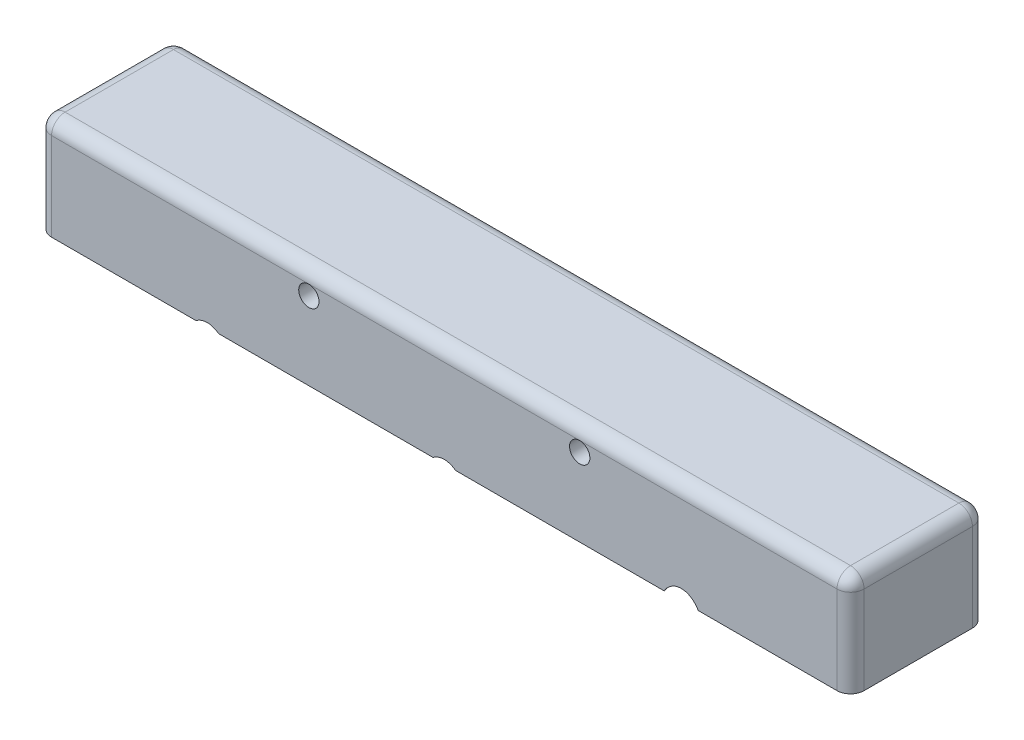
from build123d import *

# Parameters (mm, degrees)
SKETCH1_W           = 120
SKETCH1_H           = 15
BOSS_EXTRUDE1_DEPTH = 15
CUT_EXTRUDE4_START  = -3
SKETCH2_R           = 6
CUT_EXTRUDE4_DEPTH  = 114
SKETCH3_W           = 120
SKETCH3_H           = 15
BOSS_EXTRUDE2_DEPTH = 5
SKETCH5_R           = 3
CUT_EXTRUDE5_DEPTH  = 11
SKETCH6_R           = 1.5
CUT_EXTRUDE6_DEPTH  = 66
FILLET2_R           = 2
FILLET3_R           = 2
FILLET4_R           = 2
FILLET5_R           = 2


with BuildPart() as part:
    # Sketch1 → Boss-Extrude1 (new body)
    with BuildSketch(Plane(origin=(0, 0, 0), x_dir=(1, 0, 0), z_dir=(0, 1, 0))):
        Rectangle(SKETCH1_W, SKETCH1_H)
    extrude(amount=BOSS_EXTRUDE1_DEPTH)

    # Sketch2 → Cut-Extrude4 (cut)
    with BuildSketch(Plane.ZY.offset(60).offset(CUT_EXTRUDE4_START)):
        Circle(SKETCH2_R)
    extrude(amount=-CUT_EXTRUDE4_DEPTH, mode=Mode.SUBTRACT)

    # Sketch3 → Boss-Extrude2 (add)
    with BuildSketch(Plane.XY.offset(7.5)):
        with Locations((0, 7.5)):
            Rectangle(SKETCH3_W, SKETCH3_H)
    extrude(amount=BOSS_EXTRUDE2_DEPTH)

    # Sketch5 → Cut-Extrude5 (cut)
    with BuildSketch(Plane(origin=(0, -5.412658774, 9.375), x_dir=(1, 0, 0), z_dir=(0, -0.499999999999998, 0.8660254037844398))):
        with Locations((-35, 3.75)):
            Circle(SKETCH5_R)
        with Locations((0, 3.75)):
            Circle(SKETCH5_R)
        with Locations((35, 4.610408675)):
            Circle(SKETCH5_R)
    extrude(amount=-CUT_EXTRUDE5_DEPTH, mode=Mode.SUBTRACT)

    # Sketch6 → Cut-Extrude6 (cut, through all)
    with BuildSketch(Plane.XY.offset(12.5)):
        with Locations((-20, 11.5)):
            Circle(SKETCH6_R)
        with Locations((20, 11.5)):
            Circle(SKETCH6_R)
    extrude(amount=-CUT_EXTRUDE6_DEPTH, mode=Mode.SUBTRACT)

    # Fillet2
    fillet2_edges = [part.edges().sort_by_distance(p)[0] for p in [
        (0, 15, -7.5),
    ]]
    fillet(fillet2_edges, radius=FILLET2_R - 0.0001)  # a hair under: the kernel refuses the full size

    # Fillet3
    fillet3_edges = [part.edges().sort_by_distance(p)[0] for p in [
        (0, 15, 12.5),
    ]]
    fillet(fillet3_edges, radius=FILLET3_R - 0.0001)  # a hair under: the kernel refuses the full size

    # Fillet4
    fillet4_edges = [part.edges().sort_by_distance(p)[0] for p in [
        (-60, 6.50005, -7.5),
        (-60, 15, 2.5),
        (-60, 14.414242852, -6.914242852),
        (-60, 6.50005, 12.5),
        (-60, 14.414242852, 11.914242852),
    ]]
    fillet(fillet4_edges, radius=FILLET4_R - 0.0001)  # a hair under: the kernel refuses the full size

    # Fillet5
    fillet5_edges = [part.edges().sort_by_distance(p)[0] for p in [
        (60, 6.50005, 12.5),
        (60, 6.50005, -7.5),
        (60, 14.414242852, -6.914242852),
        (60, 15, 2.5),
        (60, 14.414242852, 11.914242852),
    ]]
    fillet(fillet5_edges, radius=FILLET5_R - 0.0001)  # a hair under: the kernel refuses the full size


solid = part.part
